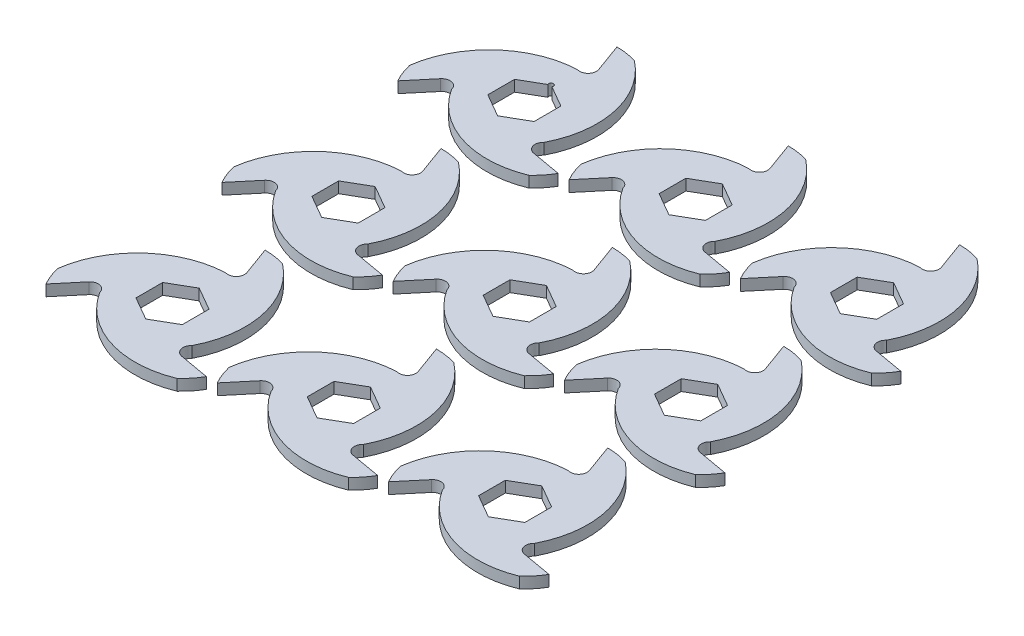
from build123d import *

# Parameters (mm, degrees)
BOSS_EXTRUDE2_DEPTH = 3.048
CUT_EXTRUDE1_DEPTH  = 71.864800629
LPATTERN1_COUNT     = 3
LPATTERN1_PITCH     = 96.52
LPATTERN1_2_COUNT   = 3
LPATTERN1_2_PITCH   = 93.98
SKETCH4_R           = 1.27
CUT_EXTRUDE2_DEPTH  = 328.527477204


with BuildPart() as part:
    # Sketch2 → Boss-Extrude2 (new, symmetric)
    with BuildSketch(Plane(origin=(0, 0, 0), x_dir=(1, 0, 0), z_dir=(0, 1, 0))):
        with BuildLine():
            Line((0, 50.8), (5.699182497, 35.141624781))
            ThreePointArc((5.699182497, 35.141624781), (4.697625818, 30.400196659), (0, 29.21))
            ThreePointArc((0, 29.21), (-40.712457699, 16.982230342), (-43.994090512, -25.4))
            Line((-43.994090512, -25.4), (-33.283131039, -12.635175567))
            ThreePointArc((-33.283131039, -12.635175567), (-28.676155496, -11.131835033), (-25.296602045, -14.605))
            ThreePointArc((-25.296602045, -14.605), (5.64918596, -43.749137789), (43.994090512, -25.4))
            Line((43.994090512, -25.4), (27.583948542, -22.506449213))
            ThreePointArc((27.583948542, -22.506449213), (23.978529677, -19.268361626), (25.296602045, -14.605))
            ThreePointArc((25.296602045, -14.605), (35.063271738, 26.766907447), (0, 50.8))
        make_face()
        Polygon((12.7, 7.332348419), (12.7, -7.332348419), (0, -14.664696837), (-12.7, -7.332348419), (-12.7, 7.332348419), (0, 14.664696837), align=None, mode=Mode.SUBTRACT)
    extrude(amount=BOSS_EXTRUDE2_DEPTH, both=True)

    # Sketch3 → Cut-Extrude1 (cut, through all)
    with BuildSketch(Plane(origin=(0, 3.048, 0), x_dir=(1, 0, 0), z_dir=(0, 1, 0))):
        with BuildLine():
            ThreePointArc((-25.296602045, -14.605), (0.069562989, -42.437673587), (36.840744267, -34.314849269))
            ThreePointArc((36.840744267, -34.314849269), (2.193682996, -35.741164715), (-25.296602045, -14.605))
        make_face()
        with BuildLine():
            ThreePointArc((11.297159061, 49.062445064), (29.855915106, 19.77036756), (25.296602045, -14.605))
            ThreePointArc((25.296602045, -14.605), (36.717321909, 21.279080109), (11.297159061, 49.062445064))
        make_face()
        with BuildLine():
            ThreePointArc((0, 29.21), (-36.786884898, 21.158593478), (-48.137903328, -14.747595795))
            ThreePointArc((-48.137903328, -14.747595795), (-32.049598102, 15.970797155), (0, 29.21))
        make_face()
    extrude(amount=-CUT_EXTRUDE1_DEPTH, mode=Mode.SUBTRACT)


with BuildPart() as lpattern1_1:
    # LPattern1: pattern copy
    add(part.part.moved(Location(Vector(0, 0, 1) * (1 * LPATTERN1_PITCH))))


with BuildPart() as lpattern1_2:
    # LPattern1: pattern copy
    add(part.part.moved(Location(Vector(0, 0, 1) * (2 * LPATTERN1_PITCH))))


with BuildPart() as lpattern1_2_1:
    # LPattern1 2: pattern copy
    add(part.part.moved(Location(Vector(1, 0, 0) * (1 * LPATTERN1_2_PITCH))))


with BuildPart() as lpattern1_2_2:
    # LPattern1 2: pattern copy
    add(part.part.moved(Location(Vector(1, 0, 0) * (2 * LPATTERN1_2_PITCH))))


with BuildPart() as lpattern1_2_3:
    # LPattern1 2: pattern copy
    add(lpattern1_1.part.moved(Location(Vector(1, 0, 0) * (1 * LPATTERN1_2_PITCH))))


with BuildPart() as lpattern1_2_4:
    # LPattern1 2: pattern copy
    add(lpattern1_1.part.moved(Location(Vector(1, 0, 0) * (2 * LPATTERN1_2_PITCH))))


with BuildPart() as lpattern1_2_5:
    # LPattern1 2: pattern copy
    add(lpattern1_2.part.moved(Location(Vector(1, 0, 0) * (1 * LPATTERN1_2_PITCH))))


with BuildPart() as lpattern1_2_6:
    # LPattern1 2: pattern copy
    add(lpattern1_2.part.moved(Location(Vector(1, 0, 0) * (2 * LPATTERN1_2_PITCH))))


with BuildPart() as part_1:
    add(part.part)

    # Sketch4 → Cut-Extrude2 (cut, through all)
    with BuildSketch(Plane(origin=(0, 3.048, 0), x_dir=(1, 0, 0), z_dir=(0, 1, 0))):
        with Locations((0, 14.664696837)):
            Circle(SKETCH4_R)
    extrude(amount=-CUT_EXTRUDE2_DEPTH, mode=Mode.SUBTRACT)


solid = Compound([lpattern1_1.part, lpattern1_2.part, lpattern1_2_1.part, lpattern1_2_2.part, lpattern1_2_3.part, lpattern1_2_4.part, lpattern1_2_5.part, lpattern1_2_6.part, part_1.part])
